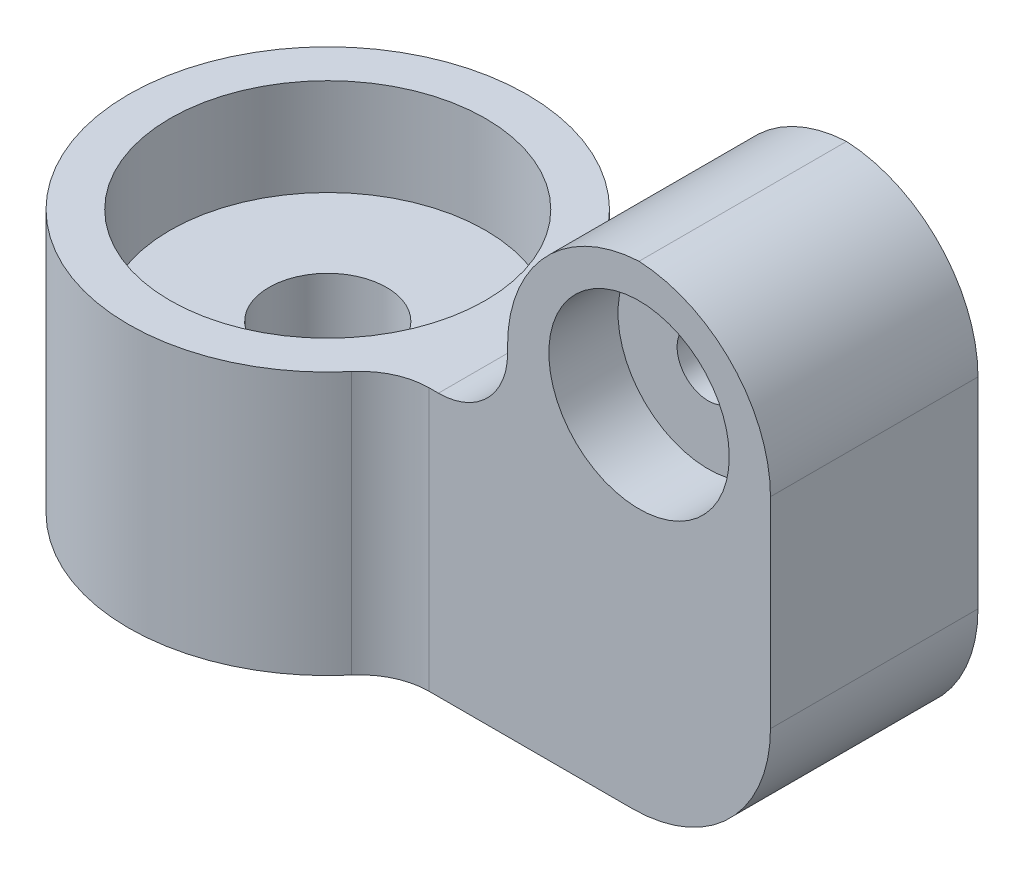
from build123d import *

# Parameters (mm, degrees)
SKETCH1_R               = 6.52
SKETCH1_R_2             = 2.25
BOSS_EXTRUDE1_DEPTH     = 7.5
CUT_EXTRUDE1_START      = 7.5
SKETCH1_3_R             = 6.52
CUT_EXTRUDE1_DEPTH      = 5
CUT_EXTRUDE2_START      = -2.5
SKETCH1_4_R             = 6.52
CUT_EXTRUDE2_DEPTH      = 5
SKETCH2_R               = 14.4
BOSS_EXTRUDE2_DEPTH     = 19
CUT_EXTRUDE3_DEPTH      = 51.395634732
CUT_EXTRUDE3_DEPTH_BACK = 51.395634732
CUT_EXTRUDE4_DEPTH      = 7
CUT_EXTRUDE5_START      = -12
SKETCH2_5_R             = 11.4
CUT_EXTRUDE5_DEPTH      = 7
FILLET1_R               = 5
FILLET2_R               = 10


with BuildPart() as part:
    # Sketch1 → Boss-Extrude1 (new, symmetric)
    # profile 1 of 3: a face of its own
    with BuildSketch(Plane.XY):
        Polygon((-4.7e-08, -6.52), (-9.5, -6.52), (-16.20264212, -6.52), (-30, -6.52), (-30, -25.52), (9.5, -25.52), (9.5, -6.52), align=None)
    # profile 2 of 3: a face of its own
    with BuildSketch(Plane.XY):
        Polygon((9.5, 9), (-9.5, 9), (-9.5, -6.52), (-4.7e-08, -6.52), (9.5, -6.52), align=None)
        with BuildLine():
            ThreePointArc((6.52, 0), (4.610336197, -4.61033623), (-4.7e-08, -6.52))
            ThreePointArc((-4.7e-08, -6.52), (-4.610336197, 4.61033623), (6.52, 0))
        make_face(mode=Mode.SUBTRACT)
    # profile 3 of 3: a face of its own
    with BuildSketch(Plane.XY):
        Circle(SKETCH1_R)
        Circle(SKETCH1_R_2, mode=Mode.SUBTRACT)
    extrude(amount=BOSS_EXTRUDE1_DEPTH, both=True)

    # Sketch1<3> → Cut-Extrude1 (cut)
    with BuildSketch(Plane.XY.offset(CUT_EXTRUDE1_START)):
        Circle(SKETCH1_3_R)
    extrude(amount=-CUT_EXTRUDE1_DEPTH, mode=Mode.SUBTRACT)

    # Sketch1<4> → Cut-Extrude2 (cut)
    with BuildSketch(Plane.XY.offset(CUT_EXTRUDE2_START)):
        Circle(SKETCH1_4_R)
    extrude(amount=-CUT_EXTRUDE2_DEPTH, mode=Mode.SUBTRACT)

    # Sketch2 → Boss-Extrude2 (add, through all)
    with BuildSketch(Plane(origin=(0, -6.52, 0), x_dir=(1, 0, 0), z_dir=(0, 1, 0))):
        with Locations((-30, 0)):
            Circle(SKETCH2_R)
    extrude(amount=-BOSS_EXTRUDE2_DEPTH)

    # Sketch2<3> → Cut-Extrude3 (cut, two sides: drawn at the far end of the back side and taken through both)
    with BuildSketch(Plane(origin=(0, -6.52, 0), x_dir=(1, 0, 0), z_dir=(0, 1, 0)).offset(-CUT_EXTRUDE3_DEPTH_BACK)):
        with BuildLine():
            ThreePointArc((-30, -4.25), (-26.99479618, -3.00520382), (-25.75, 0))
            ThreePointArc((-25.75, 0), (-26.99479618, 3.00520382), (-30, 4.25))
            Line((-30, 4.25), (-30, -4.25))
        make_face()
        with BuildLine():
            Line((-30, -4.25), (-30, 4.25))
            ThreePointArc((-30, 4.25), (-34.25, 0), (-30, -4.25))
        make_face()
    extrude(amount=CUT_EXTRUDE3_DEPTH + CUT_EXTRUDE3_DEPTH_BACK, mode=Mode.SUBTRACT)

    # Sketch2<4> → Cut-Extrude4 (cut)
    with BuildSketch(Plane(origin=(0, -6.52, 0), x_dir=(1, 0, 0), z_dir=(0, 1, 0))):
        with BuildLine():
            ThreePointArc((-21.414547187, -7.5), (-19.326805491, -4.005361278), (-18.6, 0))
            ThreePointArc((-18.6, 0), (-19.326805491, 4.005361278), (-21.414547187, 7.5))
            Line((-21.414547187, 7.5), (-30, 7.5))
            Line((-30, 7.5), (-30, 4.25))
            ThreePointArc((-30, 4.25), (-26.99479618, 3.00520382), (-25.75, 0))
            ThreePointArc((-25.75, 0), (-26.99479618, -3.00520382), (-30, -4.25))
            Line((-30, -4.25), (-30, -7.5))
            Line((-30, -7.5), (-21.414547187, -7.5))
        make_face()
        with BuildLine():
            Line((-30, 7.5), (-21.414547187, 7.5))
            ThreePointArc((-21.414547187, 7.5), (-41.4, 0), (-21.414547187, -7.5))
            Line((-21.414547187, -7.5), (-30, -7.5))
            Line((-30, -7.5), (-30, -4.25))
            ThreePointArc((-30, -4.25), (-34.25, 0), (-30, 4.25))
            Line((-30, 4.25), (-30, 7.5))
        make_face()
    extrude(amount=-CUT_EXTRUDE4_DEPTH, mode=Mode.SUBTRACT)

    # Sketch2<5> → Cut-Extrude5 (cut)
    with BuildSketch(Plane(origin=(0, -6.52, 0), x_dir=(1, 0, 0), z_dir=(0, 1, 0)).offset(CUT_EXTRUDE5_START)):
        with Locations(Location((-30, 0, 0), (0, 0, 270))):
            Circle(SKETCH2_5_R)
    extrude(amount=-CUT_EXTRUDE5_DEPTH, mode=Mode.SUBTRACT)

    # Fillet1
    fillet1_edges = [part.edges().sort_by_distance(p)[0] for p in [
        (-9.5, -6.52, 0),
        (-17.707319251, -16.02, -7.5),
        (-17.707319251, -16.02, 7.5),
    ]]
    fillet(fillet1_edges, radius=FILLET1_R)

    # Fillet2
    # the kernel refuses this fillet: 10 mm, written as the material it takes off along each edge
    with BuildSketch(Plane(origin=(-9.5, 9, -32.5), x_dir=(0, -1, 0), z_dir=(0, 0, 1)), Plane(origin=(9.5, 9, -32.5), x_dir=(-1, 0, 0), z_dir=(0, 0, 1)), Plane(origin=(9.5, -25.52, 32.5), x_dir=(-1, 0, 0), z_dir=(0, 0, -1))) as fillet2_piece_1:
        with BuildLine():
            CenterArc((FILLET2_R, FILLET2_R), FILLET2_R, 180, 90)
            Line((0, FILLET2_R), (0, 0))
            Line((0, 0), (FILLET2_R, 0))
        make_face()
    extrude(amount=65, mode=Mode.SUBTRACT)


solid = part.part
